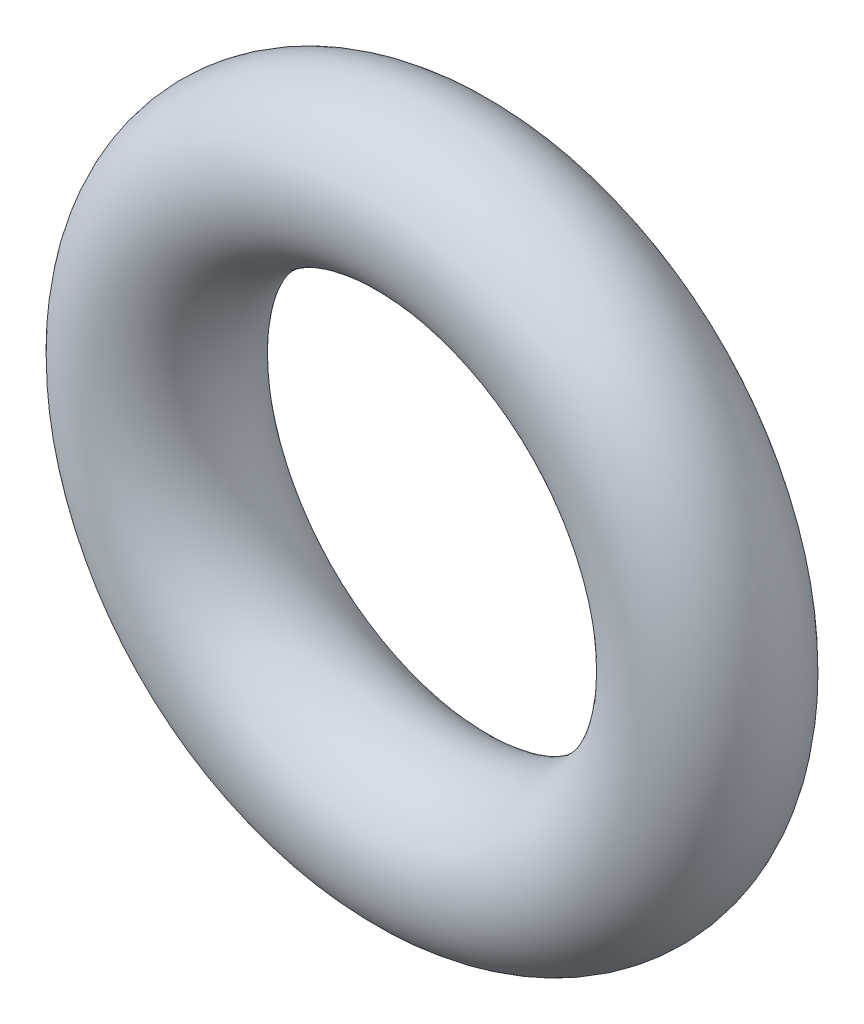
from build123d import *

# Parameters (mm, degrees)
SKETCH1_R = 0.889


with BuildPart() as part:
    # Sketch1 → Revolve1 (revolve)
    with BuildSketch(Plane(origin=(0, 0, 0), x_dir=(0, 0, -1), z_dir=(1, 0, 0))):
        with Locations((0, 3.1242)):
            Circle(SKETCH1_R)
    revolve(axis=Axis((0, 0, 0), (0, 0, -1)))


solid = part.part
